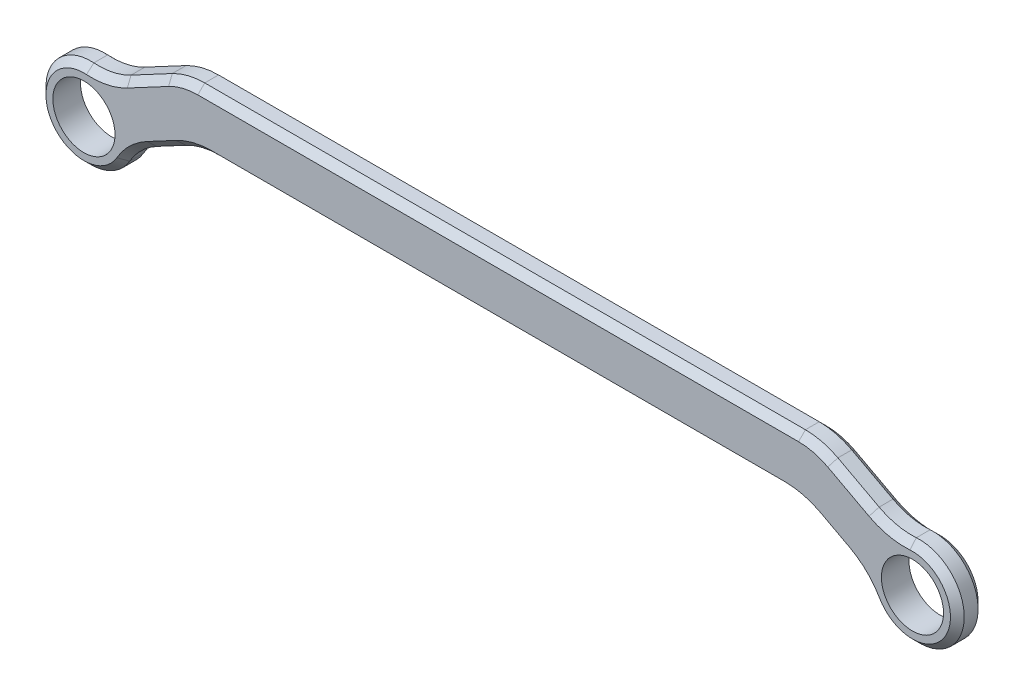
from build123d import *

# Parameters (mm, degrees)
SKETCH1_R           = 4.5
BOSS_EXTRUDE1_DEPTH = 4
FILLET1_R           = 10
CHAMFER1_SIZE       = 1


with BuildPart() as part:
    # Sketch1 → Boss-Extrude1 (new body)
    with BuildSketch(Plane.XY):
        with BuildLine():
            Line((14, 12), (2.638360632, 5.940459004))
            ThreePointArc((2.638360632, 5.940459004), (-5.735294118, -3.058823529), (6.403066514, -1.118364526))
            Line((6.403066514, -1.118364526), (16, 4))
            Line((16, 4), (104, 4))
            Line((104, 4), (113.596933486, -1.118364526))
            ThreePointArc((113.596933486, -1.118364526), (125.735294118, -3.058823529), (117.361639368, 5.940459004))
            Line((117.361639368, 5.940459004), (106, 12))
            Line((106, 12), (14, 12))
        make_face()
        Circle(SKETCH1_R, mode=Mode.SUBTRACT)
        with Locations((120, 0)):
            Circle(SKETCH1_R, mode=Mode.SUBTRACT)
    extrude(amount=BOSS_EXTRUDE1_DEPTH)

    # Fillet1
    fillet1_edges = [part.edges().sort_by_distance(p)[0] for p in [
        (113.596933486, -1.118364526, 2),
        (117.361639368, 5.940459004, 2),
        (104, 4, 2),
        (106, 12, 2),
        (16, 4, 2),
        (14, 12, 2),
        (6.403066514, -1.118364526, 2),
        (2.638360632, 5.940459004, 2),
    ]]
    fillet(fillet1_edges, radius=FILLET1_R)

    # Chamfer1
    chamfer1_edges = [part.edges().sort_by_distance(p)[0] for p in [
        (60, 4, 0),
        (16.07464375, 3.701425001, 0),
        (103.92535625, 3.701425001, 0),
        (11.690643205, 1.701676376, 0),
        (108.309356795, 1.701676376, 0),
        (7.340335622, -1.056234523, 0),
        (112.659664378, -1.056234523, 0),
        (-5.735294118, -3.058823529, 0),
        (125.735294118, -3.058823529, 0),
        (3.21210294, 6.684201756, 0),
        (116.78789706, 6.684201756, 0),
        (8.808290264, 9.231088141, 0),
        (111.191709736, 9.231088141, 0),
        (14.07464375, 11.701425001, 0),
        (105.92535625, 11.701425001, 0),
        (60, 12, 0),
        (60, 4, 4),
        (16.07464375, 3.701425001, 4),
        (103.92535625, 3.701425001, 4),
        (11.690643205, 1.701676376, 4),
        (108.309356795, 1.701676376, 4),
        (7.340335622, -1.056234523, 4),
        (112.659664378, -1.056234523, 4),
        (-5.735294118, -3.058823529, 4),
        (125.735294118, -3.058823529, 4),
        (3.21210294, 6.684201756, 4),
        (116.78789706, 6.684201756, 4),
        (8.808290264, 9.231088141, 4),
        (111.191709736, 9.231088141, 4),
        (14.07464375, 11.701425001, 4),
        (105.92535625, 11.701425001, 4),
        (60, 12, 4),
    ]]
    chamfer(chamfer1_edges, length=CHAMFER1_SIZE)


solid = part.part
